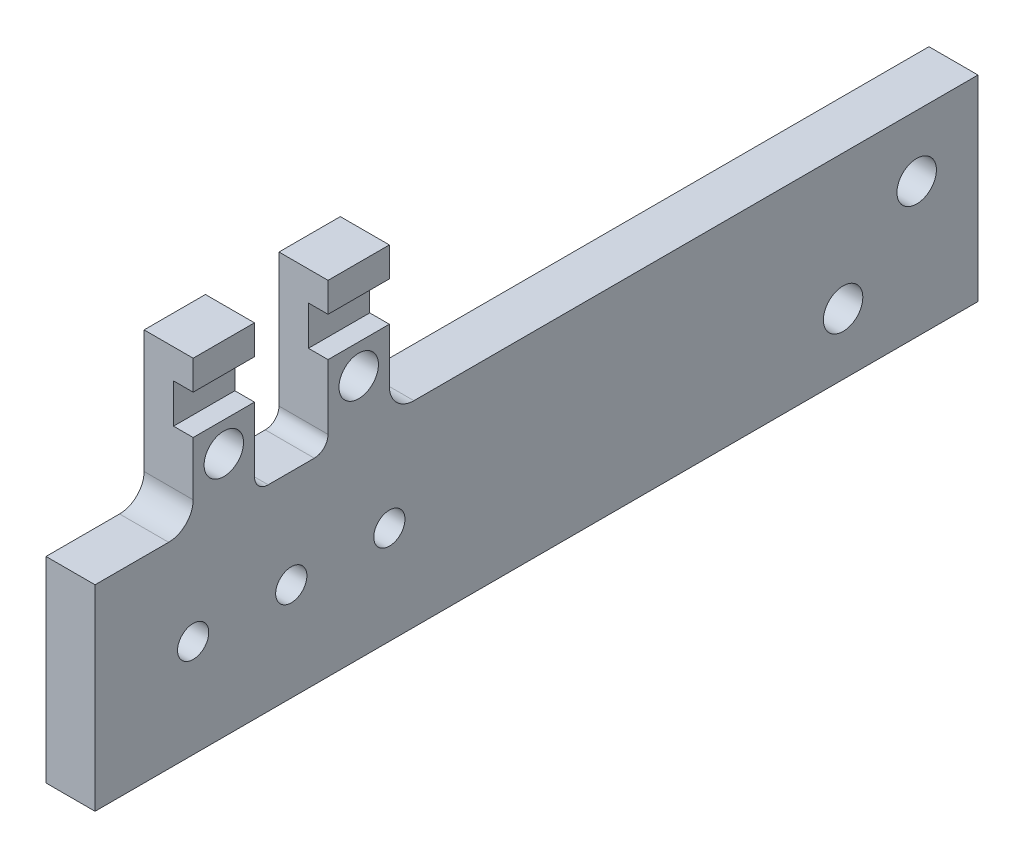
from build123d import *

# Parameters (mm, degrees)
BOSS_EXTRUDE1_DEPTH    = 6.35
F_10_32_TAPPED_HOLE1_D = 4.0386
F_10_CLEARANCE_HOLE1_D = 5.1054
SKETCH6_W              = 25.4
SKETCH6_H              = 5.08
CUT_EXTRUDE1_DEPTH     = 2.54


with BuildPart() as part:
    # Sketch1 → Boss-Extrude1 (new body)
    with BuildSketch(Plane(origin=(0, 0, 0), x_dir=(0, 0, -1), z_dir=(1, 0, 0))):
        with BuildLine():
            Line((0, 0), (114.3, 0))
            Line((114.3, 0), (114.3, 25.4))
            Line((114.3, 25.4), (41.275, 25.4))
            ThreePointArc((41.275, 25.4), (39.02993597, 26.32993597), (38.1, 28.575))
            Line((38.1, 28.575), (38.1, 44.45))
            Line((38.1, 44.45), (30.1625, 44.45))
            Line((30.1625, 44.45), (30.1625, 27.178))
            ThreePointArc((30.1625, 27.178), (29.641735857, 25.920764143), (28.3845, 25.4))
            Line((28.3845, 25.4), (22.4155, 25.4))
            ThreePointArc((22.4155, 25.4), (21.158264143, 25.920764143), (20.6375, 27.178))
            Line((20.6375, 27.178), (20.6375, 44.45))
            Line((20.6375, 44.45), (12.7, 44.45))
            Line((12.7, 44.45), (12.7, 28.575))
            ThreePointArc((12.7, 28.575), (11.77006403, 26.32993597), (9.525, 25.4))
            Line((9.525, 25.4), (0, 25.4))
            Line((0, 25.4), (0, 0))
        make_face()
    extrude(amount=BOSS_EXTRUDE1_DEPTH)

    # #10-32 Tapped Hole1 (through all)
    with Locations(Plane(origin=(6.35, 0, 0), x_dir=(0, 0, -1), z_dir=(1, 0, 0))):
        with Locations((12.7, 12.7), (25.4, 12.7), (38.1, 12.7)):
            Hole(F_10_32_TAPPED_HOLE1_D / 2)

    # #10 Clearance Hole1 (through all)
    with Locations(Plane(origin=(6.35, 0, 0), x_dir=(0, 0, -1), z_dir=(1, 0, 0))):
        with Locations((106.3625, 17.4625), (96.8375, 7.9375), (34.13125, 31.75), (16.66875, 31.75)):
            Hole(F_10_CLEARANCE_HOLE1_D / 2)

    # Sketch6 → Cut-Extrude1 (cut)
    with BuildSketch(Plane(origin=(6.35, 0, 0), x_dir=(0, 0, -1), z_dir=(1, 0, 0))):
        with Locations((25.4, 38.1)):
            Rectangle(SKETCH6_W, SKETCH6_H)
    extrude(amount=-CUT_EXTRUDE1_DEPTH, mode=Mode.SUBTRACT)


solid = part.part
